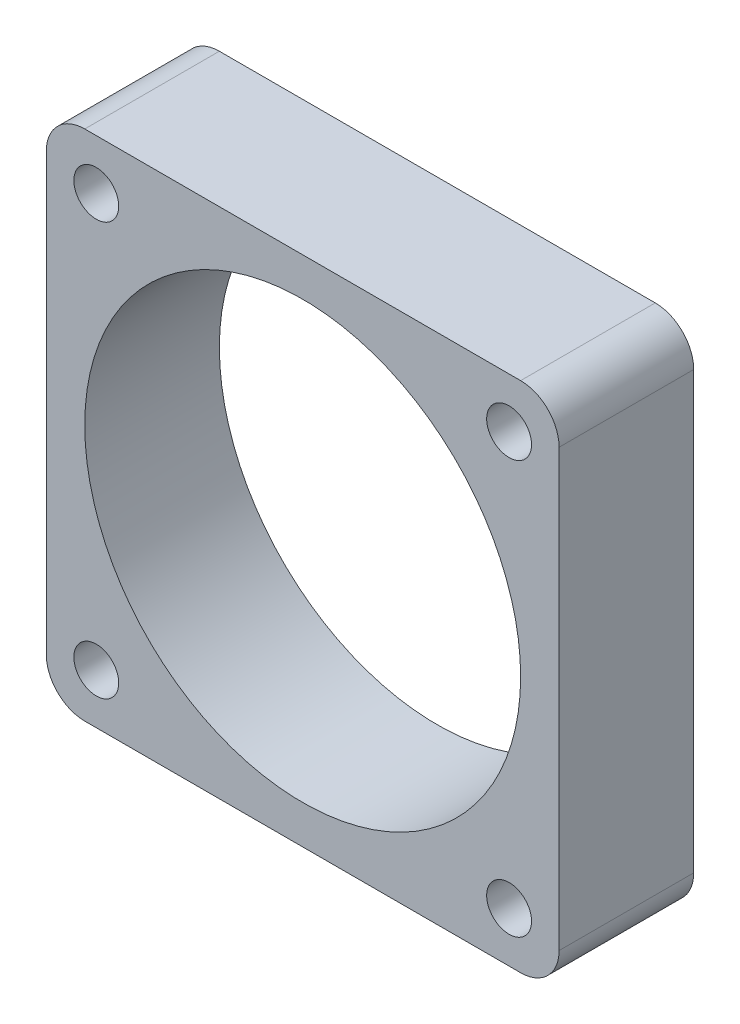
from build123d import *

# Parameters (mm, degrees)
EXTRUDE_1_DEPTH     = 10.5
SKETCH_2_R          = 1.75
CUT_EXTRUDE_1_DEPTH = 58.534772095
CUT_EXTRUDE_2_REACH = 59.535
SKETCH_3_R          = 17


with BuildPart() as part:
    # 草图1 → 凸台-拉伸1 (new body)
    with BuildSketch(Plane.XY):
        with BuildLine():
            Line((3, 0), (37, 0))
            ThreePointArc((37, 0), (39.121320344, 0.878679656), (40, 3))
            Line((40, 3), (40, 37))
            ThreePointArc((40, 37), (39.121320344, 39.121320344), (37, 40))
            Line((37, 40), (3, 40))
            ThreePointArc((3, 40), (0.878679656, 39.121320344), (0, 37))
            Line((0, 37), (0, 3))
            ThreePointArc((0, 3), (0.878679656, 0.878679656), (3, 0))
        make_face()
    extrude(amount=EXTRUDE_1_DEPTH)

    # 草图2 → 切除-拉伸1 (cut, through all)
    with BuildSketch(Plane.XY.offset(10.5)):
        with Locations((3.9, 36.1)):
            Circle(SKETCH_2_R)
        with Locations((36.1, 36.1)):
            Circle(SKETCH_2_R)
        with Locations((3.9, 3.9)):
            Circle(SKETCH_2_R)
        with Locations((36.1, 3.9)):
            Circle(SKETCH_2_R)
    extrude(amount=-CUT_EXTRUDE_1_DEPTH, mode=Mode.SUBTRACT)

    # 草图3 → 切除-拉伸2 (cut, up to next)
    with BuildSketch(Plane.XY.offset(10.5), mode=Mode.PRIVATE) as cut_extrude_2_sk1:
        with Locations((20, 20)):
            Circle(SKETCH_3_R)
    cut_extrude_2_tool1 = extrude(cut_extrude_2_sk1.sketch, amount=-CUT_EXTRUDE_2_REACH, mode=Mode.PRIVATE) & part.part
    add(cut_extrude_2_tool1.solids().sort_by_distance((20, 20, 10.5))[0], mode=Mode.SUBTRACT)


solid = part.part
